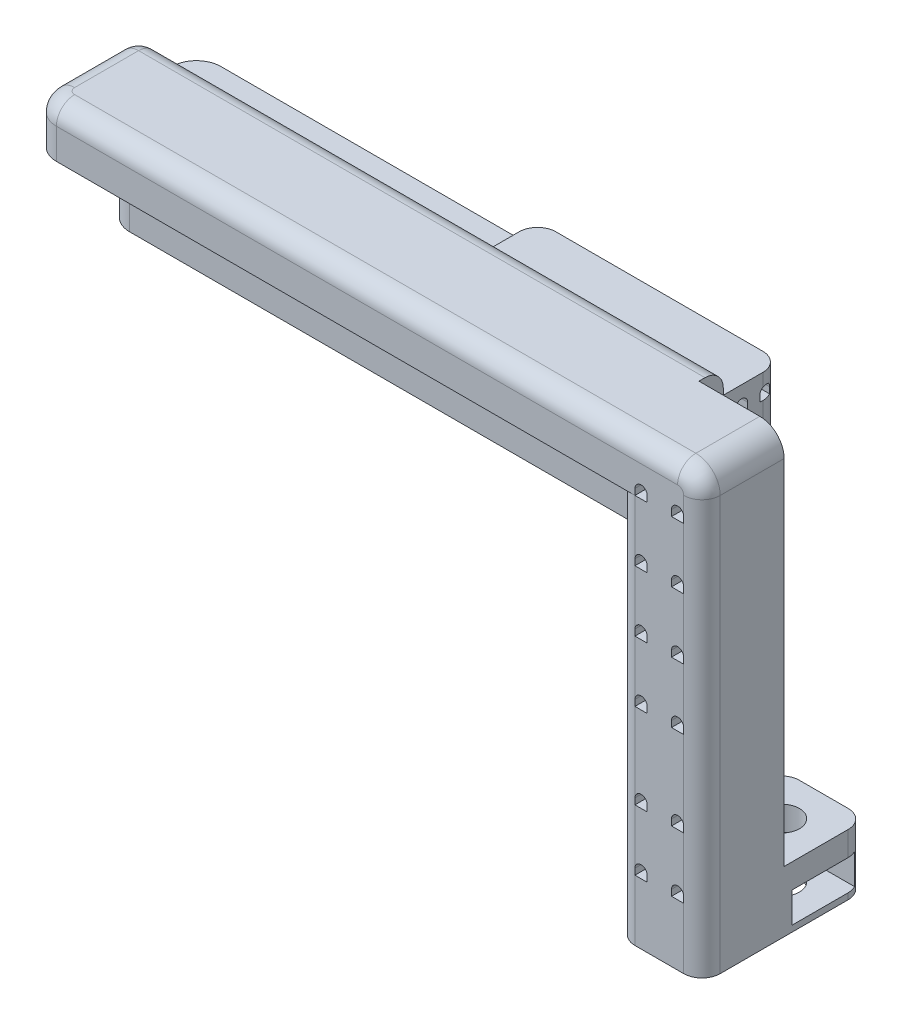
from build123d import *

# Parameters (mm, degrees)
SKETCH1_W            = 55
SKETCH1_H            = 16
BOSS_EXTRUDE1_DEPTH  = 4
SKETCH2_W            = 50
SKETCH2_H            = 8
BOSS_EXTRUDE2_DEPTH  = 8
SKETCH3_W            = 5
SKETCH3_H            = 16
BOSS_EXTRUDE3_DEPTH  = 28
SKETCH4_R            = 1.45
CUT_EXTRUDE2_DEPTH   = 10
CUT_EXTRUDE4_START   = -3
CUT_EXTRUDE4_DEPTH   = 3
CUT_EXTRUDE5_DEPTH   = 5
SKETCH8_W            = 50
SKETCH8_H            = 2
CUT_EXTRUDE6_DEPTH   = 4
CUT_EXTRUDE7_START   = -50
SKETCH9_W            = 0.5
SKETCH9_H            = 8
CUT_EXTRUDE7_DEPTH   = 50
CUT_EXTRUDE8_START   = -55
SKETCH10_W           = 0.5
SKETCH10_H           = 32
CUT_EXTRUDE8_DEPTH   = 55
CUT_EXTRUDE9_DEPTH   = 3
CUT_EXTRUDE11_DEPTH  = 3
BOSS_EXTRUDE4_START  = 2
SKETCH17_W           = 15
SKETCH17_H           = 32
BOSS_EXTRUDE4_DEPTH  = 2
SKETCH18_W           = 7
SKETCH18_H           = 1.5
CUT_EXTRUDE12_DEPTH  = 32
FILLET1_R            = 2
SKETCH19_W           = 13.5
SKETCH19_H           = 32
CUT_EXTRUDE13_DEPTH  = 7
SKETCH20_W           = 7
SKETCH20_H           = 13.5
BOSS_EXTRUDE5_DEPTH  = 40
CUT_EXTRUDE14_DEPTH  = 13.5
FILLET2_R            = 2
CUT_EXTRUDE15_REACH  = 69.209
SKETCH22_W           = 6.75
SKETCH22_H           = 40
LPATTERN1_COUNT      = 4
LPATTERN1_PITCH      = 5
SKETCH23_W           = 4.75
SKETCH23_H           = 4
CUT_EXTRUDE16_DEPTH  = 48
BOSS_EXTRUDE9_START  = -27
SKETCH29_W           = 7
SKETCH29_H           = 6.75
SKETCH29_R           = 1.45
BOSS_EXTRUDE9_DEPTH  = 5
CUT_EXTRUDE19_START  = -2
CUT_EXTRUDE19_DEPTH  = 2.5
BOSS_EXTRUDE11_DEPTH = 20
SKETCH35_W           = 7
SKETCH35_H           = 4
CUT_EXTRUDE20_DEPTH  = 6.75
FILLET3_R            = 1.5
CUT_EXTRUDE21_DEPTH  = 6.75


# Read off the part's stored shape, not the designer's step: Cut-Extrude4
with BuildPart() as part:
    # Sketch1 → Boss-Extrude1 (new body)
    with BuildSketch(Plane(origin=(0, 0, 0), x_dir=(1, 0, 0), z_dir=(0, 1, 0))):
        with Locations((27.5, 8)):
            Rectangle(SKETCH1_W, SKETCH1_H)
    extrude(amount=BOSS_EXTRUDE1_DEPTH)

    # Sketch2 → Boss-Extrude2 (add)
    with BuildSketch(Plane.XZ):
        with Locations((25, -10)):
            Rectangle(SKETCH2_W, SKETCH2_H)
    extrude(amount=BOSS_EXTRUDE2_DEPTH)

    # Sketch3 → Boss-Extrude3 (add)
    with BuildSketch(Plane.XZ):
        with Locations((52.5, -8)):
            Rectangle(SKETCH3_W, SKETCH3_H)
    extrude(amount=BOSS_EXTRUDE3_DEPTH)

    # Sketch4 → Cut-Extrude2 (cut)
    with BuildSketch(Plane.XY.offset(-6)):
        with Locations((10, -4)):
            Circle(SKETCH4_R)
        with Locations((20, -4)):
            Circle(SKETCH4_R)
        with Locations((30, -4)):
            Circle(SKETCH4_R)
        with Locations((40, -4)):
            Circle(SKETCH4_R)
    extrude(amount=-CUT_EXTRUDE2_DEPTH, mode=Mode.SUBTRACT)

    # Cut-Extrude4 outline → Cut-Extrude4 (cut)
    with BuildSketch(Plane.ZY.offset(-50).offset(CUT_EXTRUDE4_START)):
        Polygon((-6.598076211, -25.5), (-4, -27), (-1.401923789, -25.5), (-1.401923789, 0), (-6, 0), (-6, -8), (-6.598076211, -8), align=None)
        Polygon((-7.401923789, -25.5), (-7.401923789, -8), (-12.598076211, -8), (-12.598076211, -25.5), (-10, -27), align=None)
    extrude(amount=CUT_EXTRUDE4_DEPTH, mode=Mode.SUBTRACT)

    # Sketch7 → Cut-Extrude5 (cut)
    with BuildSketch(Plane.ZY.offset(-50)):
        with BuildLine():
            Line((-11.45, -12), (-11.45, -24))
            ThreePointArc((-11.45, -24), (-10, -25.45), (-8.55, -24))
            Line((-8.55, -24), (-8.55, -12))
            ThreePointArc((-8.55, -12), (-10, -10.55), (-11.45, -12))
        make_face()
        with BuildLine():
            Line((-2.55, -12), (-2.55, -24))
            ThreePointArc((-2.55, -24), (-4, -25.45), (-5.45, -24))
            Line((-5.45, -24), (-5.45, -12))
            ThreePointArc((-5.45, -12), (-4, -10.55), (-2.55, -12))
        make_face()
    extrude(amount=-CUT_EXTRUDE5_DEPTH, mode=Mode.SUBTRACT)

    # Sketch8 → Cut-Extrude6 (cut)
    with BuildSketch(Plane(origin=(0, 4, 0), x_dir=(1, 0, 0), z_dir=(0, 1, 0))):
        with Locations((25, 15)):
            Rectangle(SKETCH8_W, SKETCH8_H)
    extrude(amount=-CUT_EXTRUDE6_DEPTH, mode=Mode.SUBTRACT)

    # Sketch9 → Cut-Extrude7 (cut)
    with BuildSketch(Plane.ZY.offset(CUT_EXTRUDE7_START)):
        with Locations((-6.25, -4)):
            Rectangle(SKETCH9_W, SKETCH9_H)
    extrude(amount=CUT_EXTRUDE7_DEPTH, mode=Mode.SUBTRACT)

    # Sketch10 → Cut-Extrude8 (cut)
    with BuildSketch(Plane.ZY.offset(CUT_EXTRUDE8_START)):
        with Locations((-0.25, -12)):
            Rectangle(SKETCH10_W, SKETCH10_H)
        with Locations((-15.75, -12)):
            Rectangle(SKETCH10_W, SKETCH10_H)
    extrude(amount=CUT_EXTRUDE8_DEPTH, mode=Mode.SUBTRACT)

    # Sketch11 → Cut-Extrude9 (cut)
    with BuildSketch(Plane(origin=(0, 0, -14), x_dir=(-1, 0, 0), z_dir=(0, 0, -1))):
        Polygon((-37, -4), (-38.5, -1.401923789), (-41.5, -1.401923789), (-43, -4), (-41.5, -6.598076211), (-38.5, -6.598076211), align=None)
        Polygon((-27, -4), (-28.5, -1.401923789), (-31.5, -1.401923789), (-33, -4), (-31.5, -6.598076211), (-28.5, -6.598076211), align=None)
        Polygon((-17, -4), (-18.5, -1.401923789), (-21.5, -1.401923789), (-23, -4), (-21.5, -6.598076211), (-18.5, -6.598076211), align=None)
        Polygon((-7, -4), (-8.5, -1.401923789), (-11.5, -1.401923789), (-13, -4), (-11.5, -6.598076211), (-8.5, -6.598076211), align=None)
    extrude(amount=-CUT_EXTRUDE9_DEPTH, mode=Mode.SUBTRACT)

    # Sketch15 → Cut-Extrude11 (cut)
    with BuildSketch(Plane.ZY.offset(-50)):
        Polygon((-4, -27), (-1.401923789, -25.5), (-1.401923789, 0.004821093), (-1.401923789, 4), (-6.598076211, 4), (-6.598076211, -8), (-6.598076211, -25.5), align=None)
        Polygon((-7.401923789, -25.5), (-7.401923789, -8), (-7.401923789, 4), (-12.598076211, 4), (-12.598076211, -8), (-12.598076211, -25.5), (-10, -27), align=None)
    extrude(amount=-CUT_EXTRUDE11_DEPTH, mode=Mode.SUBTRACT)

    # Sketch17 → Boss-Extrude4 (add)
    with BuildSketch(Plane.ZY.offset(-50).offset(BOSS_EXTRUDE4_START)):
        with Locations((-8, -12)):
            Rectangle(SKETCH17_W, SKETCH17_H)
        with BuildLine():
            Line((-11.45, -12), (-11.45, -24))
            ThreePointArc((-11.45, -24), (-10, -25.45), (-8.55, -24))
            Line((-8.55, -24), (-8.55, -12))
            ThreePointArc((-8.55, -12), (-10, -10.55), (-11.45, -12))
        make_face(mode=Mode.SUBTRACT)
        with BuildLine():
            Line((-5.45, -12), (-5.45, -24))
            ThreePointArc((-5.45, -24), (-4, -25.45), (-2.55, -24))
            Line((-2.55, -24), (-2.55, -12))
            ThreePointArc((-2.55, -12), (-4, -10.55), (-5.45, -12))
        make_face(mode=Mode.SUBTRACT)
    extrude(amount=-BOSS_EXTRUDE4_DEPTH)

    # Sketch18 → Cut-Extrude12 (cut)
    with BuildSketch(Plane(origin=(0, 4, 0), x_dir=(1, 0, 0), z_dir=(0, 1, 0))):
        with Locations((51.5, 14.75)):
            Rectangle(SKETCH18_W, SKETCH18_H)
    extrude(amount=-CUT_EXTRUDE12_DEPTH, mode=Mode.SUBTRACT)

    # Fillet1
    fillet1_edges = [part.edges().sort_by_distance(p)[0] for p in [
        (0, -2, -14),
        (0, -4, -6.5),
        (0, 2, -0.5),
        (55, -12, -0.5),
        (48, -14, -0.5),
        (55, -12, -14),
        (48, -18, -14),
    ]]
    fillet(fillet1_edges, radius=FILLET1_R)

    # Sketch19 → Cut-Extrude13 (cut)
    with BuildSketch(Plane(origin=(55, 0, 0), x_dir=(0, 0, -1), z_dir=(1, 0, 0))):
        with Locations((7.25, -12)):
            Rectangle(SKETCH19_W, SKETCH19_H)
    extrude(amount=-CUT_EXTRUDE13_DEPTH, mode=Mode.SUBTRACT)

    # Sketch20 → Boss-Extrude5 (add)
    with BuildSketch(Plane(origin=(0, 4, 0), x_dir=(1, 0, 0), z_dir=(0, 1, 0))):
        with Locations((51.5, 7.25)):
            Rectangle(SKETCH20_W, SKETCH20_H)
    extrude(amount=-BOSS_EXTRUDE5_DEPTH)

    # Sketch21 → Cut-Extrude14 (cut)
    with BuildSketch(Plane.XY.offset(-0.5)):
        with BuildLine():
            Line((52.5, 0.5), (52.5, 0))
            Line((52.5, 0), (53.5, 0))
            Line((53.5, 0), (53.5, 0.5))
            ThreePointArc((53.5, 0.5), (53.353553391, 0.853553391), (53, 1))
            ThreePointArc((53, 1), (52.646446609, 0.853553391), (52.5, 0.5))
        make_face()
        with BuildLine():
            Line((49.5, 0.5), (49.5, 0))
            Line((49.5, 0), (50.5, 0))
            Line((50.5, 0), (50.5, 0.5))
            ThreePointArc((50.5, 0.5), (50, 1), (49.5, 0.5))
        make_face()
    cut_extrude14 = extrude(amount=-CUT_EXTRUDE14_DEPTH, mode=Mode.SUBTRACT)

    # Fillet2
    fillet2_edges = [part.edges().sort_by_distance(p)[0] for p in [
        (48, -36, -7.25),
        (55, -36, -7.25),
        (55, 4, -7.25),
    ]]
    fillet(fillet2_edges, radius=FILLET2_R)

    # Cut-Extrude15: up to this face of the body (flat: up to its plane)
    cut_extrude15_end = Plane(part.part.faces().sort_by_distance((48, -18.954887218, -6.79887218))[0])
    # Sketch22 → Cut-Extrude15 (cut, up to the picked face)
    with BuildSketch(Plane(origin=(55, 0, 0), x_dir=(0, 0, -1), z_dir=(1, 0, 0)), mode=Mode.PRIVATE) as cut_extrude15_sk1:
        with Locations((10.625, -16)):
            Rectangle(SKETCH22_W, SKETCH22_H)
    cut_extrude15_tool1 = split(extrude(cut_extrude15_sk1.sketch, amount=-CUT_EXTRUDE15_REACH, mode=Mode.PRIVATE), bisect_by=cut_extrude15_end, keep=Keep.BOTH, mode=Mode.PRIVATE)
    add(cut_extrude15_tool1.solids().sort_by(Axis((55, -16, -10.625), (-1, 0, 0)))[0], mode=Mode.SUBTRACT)

    # LPattern1: Cut-Extrude14 ×4
    with Locations(*[(0, -i * LPATTERN1_PITCH, 0) for i in range(1, LPATTERN1_COUNT)]):
        add(cut_extrude14, mode=Mode.SUBTRACT)

    # Sketch23 → Cut-Extrude16 (cut)
    with BuildSketch(Plane(origin=(48, 0, 0), x_dir=(0, 0, -1), z_dir=(1, 0, 0))):
        with Locations((11.625, 2)):
            Rectangle(SKETCH23_W, SKETCH23_H)
    extrude(amount=-CUT_EXTRUDE16_DEPTH, mode=Mode.SUBTRACT)

    # Sketch29 → Boss-Extrude9 (add)
    with BuildSketch(Plane(origin=(0, 0, 0), x_dir=(1, 0, 0), z_dir=(0, 1, 0)).offset(BOSS_EXTRUDE9_START)):
        with Locations((51.5, 10.625)):
            Rectangle(SKETCH29_W, SKETCH29_H)
        with Locations(Location((51.5, 10.55, 0), (0, 0, 270))):
            Circle(SKETCH29_R, mode=Mode.SUBTRACT)
    extrude(amount=-BOSS_EXTRUDE9_DEPTH)

    # Sketch30 → Cut-Extrude19 (cut)
    with BuildSketch(Plane(origin=(0, -27, 0), x_dir=(1, 0, 0), z_dir=(0, 1, 0)).offset(CUT_EXTRUDE19_START)):
        Polygon((53.029978213, 13.2), (49.970021787, 13.2), (48.440043573, 10.55), (49.970021787, 7.9), (53.029978213, 7.9), (55, 7.9), (55, 13.2), align=None)
    extrude(amount=-CUT_EXTRUDE19_DEPTH, mode=Mode.SUBTRACT)

    # Sketch34 → Boss-Extrude11 (add)
    with BuildSketch(Plane(origin=(48, 0, 0), x_dir=(0, 0, -1), z_dir=(1, 0, 0))):
        with BuildLine():
            Line((14, 0), (13.25, 0))
            Line((13.25, 0), (13.25, 0.5))
            ThreePointArc((13.25, 0.5), (12.75, 1), (12.25, 0.5))
            Line((12.25, 0.5), (12.25, 0))
            Line((12.25, 0), (11.25, 0))
            Line((11.25, 0), (11.25, 0.5))
            ThreePointArc((11.25, 0.5), (10.75, 1), (10.25, 0.5))
            Line((10.25, 0.5), (10.25, 0))
            Line((10.25, 0), (9.25, 0))
            Line((9.25, 0), (9.25, 2))
            Line((9.25, 2), (14, 2))
            Line((14, 2), (14, 0))
        make_face()
    extrude(amount=-BOSS_EXTRUDE11_DEPTH)

    # Sketch35 → Cut-Extrude20 (cut)
    with BuildSketch(Plane.XY.offset(-0.5)):
        with Locations((51.5, -34)):
            Rectangle(SKETCH35_W, SKETCH35_H)
    extrude(amount=-CUT_EXTRUDE20_DEPTH, mode=Mode.SUBTRACT)

    # Fillet3
    # the kernel refuses this fillet: 1.5 mm, written as the material it takes off along each edge
    with BuildSketch(Plane(origin=(1.5, 2.5, -7.75), x_dir=(-1, 0, 0), z_dir=(0, 1, 0))) as fillet3_piece_1_section:
        Polygon((0, 0), (FILLET3_R, 0), (FILLET3_R, -FILLET3_R), (0, -FILLET3_R), align=None)
    fillet3_piece_1 = extrude(amount=FILLET3_R, mode=Mode.PRIVATE)
    fillet3_piece_1 = fillet3_piece_1 - Plane(origin=(1.5, 2.5, -7.75), x_dir=(0.7071067811865475, 0, 0.7071067811865475), z_dir=(0, 1, 0)) * Sphere(FILLET3_R, mode=Mode.PRIVATE)
    add(fillet3_piece_1, mode=Mode.SUBTRACT)
    with BuildSketch(Plane(origin=(0, 4, -7.75), x_dir=(1, 0, 0), z_dir=(0, 0, 1))) as fillet3_piece_2:
        with BuildLine():
            CenterArc((FILLET3_R, -FILLET3_R), FILLET3_R, 90, 90)
            Line((0, -FILLET3_R), (0, 0))
            Line((0, 0), (FILLET3_R, 0))
        make_face()
    extrude(amount=5.25, mode=Mode.SUBTRACT)
    with BuildSketch(Plane(origin=(2, 4, -2.5), x_dir=(-1, 0, 0), z_dir=(0, 0, -1))) as fillet3_piece_3:
        with BuildLine():
            CenterArc((2 - FILLET3_R, -FILLET3_R), FILLET3_R, 0, 90)
            Line((2, -FILLET3_R), (2, 0))
            Line((2, 0), (2 - FILLET3_R, 0))
        make_face()
    revolve(axis=Axis((2, 4, -2.5), (0, 1, 0)), revolution_arc=90, mode=Mode.SUBTRACT)
    with BuildSketch(Plane(origin=(2, 4, -0.5), x_dir=(0, 0, -1), z_dir=(1, 0, 0))) as fillet3_piece_4:
        with BuildLine():
            CenterArc((FILLET3_R, -FILLET3_R), FILLET3_R, 90, 90)
            Line((0, -FILLET3_R), (0, 0))
            Line((0, 0), (FILLET3_R, 0))
        make_face()
    extrude(amount=51, mode=Mode.SUBTRACT)
    with BuildSketch(Plane(origin=(53, 2, -0.5), x_dir=(0, 1, 0), z_dir=(-1, 0, 0))) as fillet3_piece_5:
        with BuildLine():
            CenterArc((2 - FILLET3_R, FILLET3_R), FILLET3_R, 270, 90)
            Line((2 - FILLET3_R, 0), (2, 0))
            Line((2, 0), (2, FILLET3_R))
        make_face()
    revolve(axis=Axis((53, 2, -0.5), (0, 0, -1)), revolution_arc=90, mode=Mode.SUBTRACT)
    with BuildSketch(Plane(origin=(28, 5.75, -14), x_dir=(1, 0, 0), z_dir=(0, -1, 0))) as fillet3_piece_6:
        with BuildLine():
            CenterArc((FILLET3_R, FILLET3_R), FILLET3_R, 180, 90)
            Line((0, FILLET3_R), (0, 0))
            Line((0, 0), (FILLET3_R, 0))
        make_face()
    extrude(amount=5.75, mode=Mode.SUBTRACT)
    with BuildSketch(Plane(origin=(48, -11.75, -14), x_dir=(-1, 0, 0), z_dir=(0, 1, 0))) as fillet3_piece_7:
        with BuildLine():
            CenterArc((FILLET3_R, FILLET3_R), FILLET3_R, 180, 90)
            Line((0, FILLET3_R), (0, 0))
            Line((0, 0), (FILLET3_R, 0))
        make_face()
    extrude(amount=17.5, mode=Mode.SUBTRACT)
    with BuildSketch(Plane(origin=(48, -23.25, -14), x_dir=(0, 0, 1), z_dir=(0, -1, 0))) as fillet3_piece_8:
        with BuildLine():
            CenterArc((FILLET3_R, -FILLET3_R), FILLET3_R, 90, 90)
            Line((0, -FILLET3_R), (0, 0))
            Line((0, 0), (FILLET3_R, 0))
        make_face()
    extrude(amount=12.5, mode=Mode.SUBTRACT)
    with BuildSketch(Plane(origin=(55, -23.25, -14), x_dir=(0, 0, 1), z_dir=(0, -1, 0))) as fillet3_piece_9:
        with BuildLine():
            CenterArc((FILLET3_R, FILLET3_R), FILLET3_R, 180, 90)
            Line((0, FILLET3_R), (0, 0))
            Line((0, 0), (FILLET3_R, 0))
        make_face()
    extrude(amount=12.5, mode=Mode.SUBTRACT)
    with BuildSketch(Plane(origin=(55, 2, -0.5), x_dir=(0, 0, -1), z_dir=(0, -1, 0))) as fillet3_piece_10:
        with BuildLine():
            CenterArc((FILLET3_R, -FILLET3_R), FILLET3_R, 90, 90)
            Line((0, -FILLET3_R), (0, 0))
            Line((0, 0), (FILLET3_R, 0))
        make_face()
    extrude(amount=37.75, mode=Mode.SUBTRACT)
    with BuildSketch(Plane(origin=(51.75, 4, -9.25), x_dir=(0, 0, 1), z_dir=(-1, 0, 0))) as fillet3_piece_11:
        with BuildLine():
            CenterArc((FILLET3_R, -FILLET3_R), FILLET3_R, 90, 90)
            Line((0, -FILLET3_R), (0, 0))
            Line((0, 0), (FILLET3_R, 0))
        make_face()
    extrude(amount=50.25, mode=Mode.SUBTRACT)
    with BuildSketch(Plane(origin=(0, 0, -9.25), x_dir=(1, 0, 0), z_dir=(0, 1, 0))) as fillet3_piece_12:
        with BuildLine():
            CenterArc((FILLET3_R, -FILLET3_R), FILLET3_R, 90, 90)
            Line((0, -FILLET3_R), (0, 0))
            Line((0, 0), (FILLET3_R, 0))
        make_face()
    extrude(amount=2.5, mode=Mode.SUBTRACT)
    with BuildSketch(Plane(origin=(48, 0, -0.5), x_dir=(0, 0, -1), z_dir=(0, -1, 0))) as fillet3_piece_13:
        with BuildLine():
            CenterArc((FILLET3_R, FILLET3_R), FILLET3_R, 180, 90)
            Line((0, FILLET3_R), (0, 0))
            Line((0, 0), (FILLET3_R, 0))
        make_face()
    extrude(amount=35.75, mode=Mode.SUBTRACT)

    # Sketch36 → Cut-Extrude21 (cut)
    with BuildSketch(Plane.XY.offset(-0.5)):
        with BuildLine():
            Line((49.5, -21.500032458), (49.5, -22))
            Line((49.5, -22), (50.5, -22))
            Line((50.5, -22), (50.5, -21.5))
            ThreePointArc((50.5, -21.5), (49.999983772, -21.000032458), (49.5, -21.500032458))
        make_face()
        with BuildLine():
            Line((53.5, -22), (53.5, -21.5))
            ThreePointArc((53.5, -21.5), (53, -21), (52.5, -21.5))
            Line((52.5, -21.5), (52.5, -22))
            Line((52.5, -22), (53.5, -22))
        make_face()
        with BuildLine():
            Line((49.5, -26.500032458), (49.5, -27))
            Line((49.5, -27), (50.5, -27))
            Line((50.5, -27), (50.5, -26.5))
            ThreePointArc((50.5, -26.5), (49.999983772, -26.000032458), (49.5, -26.500032458))
        make_face()
        with BuildLine():
            Line((53.5, -27), (53.5, -26.5))
            ThreePointArc((53.5, -26.5), (53, -26), (52.5, -26.5))
            Line((52.5, -26.5), (52.5, -27))
            Line((52.5, -27), (53.5, -27))
        make_face()
    extrude(amount=-CUT_EXTRUDE21_DEPTH, mode=Mode.SUBTRACT)


solid = part.part
